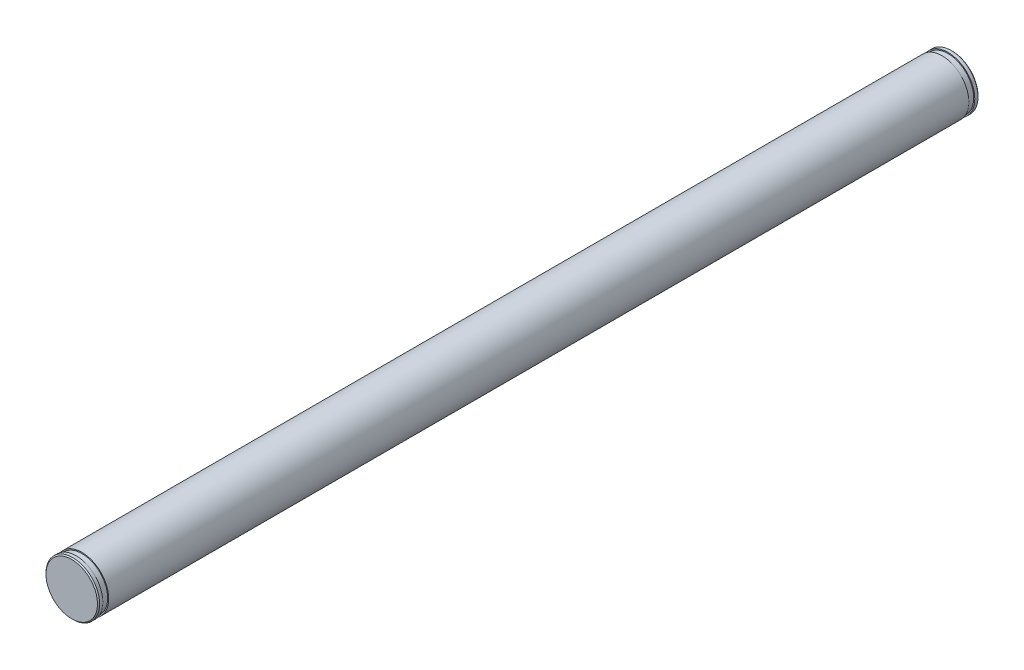
from build123d import *

# Parameters (mm, degrees)
FASE1_SIZE = 0.2


with BuildPart() as part:
    # Skizze7 → Rotation1 (revolve)
    with BuildSketch(Plane(origin=(0, 0, 0), x_dir=(0, 0, -1), z_dir=(1, 0, 0))):
        Polygon((-163.4, 5), (-163.4, 4.8), (-162.3, 4.8), (-162.3, 5), (-1.9, 5), (-1.9, 4.8), (-0.8, 4.8), (-0.8, 5), (0, 5), (0, 0), (-164.2, 0), (-164.2, 5), align=None)
    revolve(axis=Axis((0, 0, 164.2), (0, 0, -1)))

    # Fase1
    fase1_edges = [part.edges().sort_by_distance(p)[0] for p in [
        (0, -5, 0),
        (0, -5, 164.2),
    ]]
    chamfer(fase1_edges, length=FASE1_SIZE)


solid = part.part
